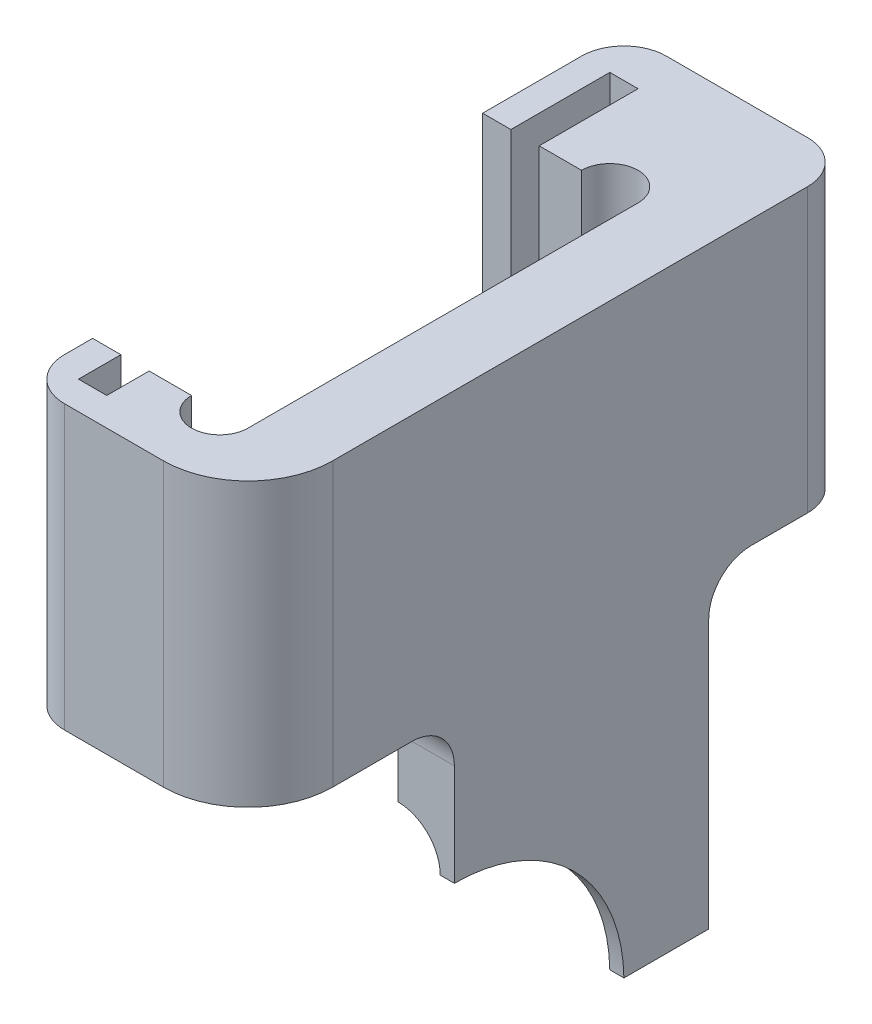
from build123d import *

# Parameters (mm, degrees)
BOSS_EXTRUDE1_DEPTH     = 20
SKETCH3_W               = 12
SKETCH3_H               = 20
BOSS_EXTRUDE2_DEPTH     = 5
FILLET1_R               = 6
FILLET2_R               = 3
SKETCH4_R               = 2
CUT_EXTRUDE1_DEPTH      = 6
SKETCH5_W               = 2
SKETCH5_H               = 20
SKETCH5_W_2             = 3
BOSS_EXTRUDE3_DEPTH     = 4
SKETCH6_W               = 2
SKETCH6_H               = 20
BOSS_EXTRUDE4_DEPTH     = 3
SKETCH7_W               = 2
SKETCH7_H               = 20
BOSS_EXTRUDE5_DEPTH     = 7
FILLET3_R               = 3
SKETCH8_W               = 18
SKETCH8_H               = 22
BOSS_EXTRUDE6_DEPTH     = 5
CUT_EXTRUDE2_DEPTH      = 36.285832851
CUT_EXTRUDE2_DEPTH_BACK = 4
CUT_EXTRUDE3_DEPTH      = 36.285832851
CUT_EXTRUDE3_DEPTH_BACK = 36.285832851
FILLET4_R               = 3
SKETCH11_W              = 18
SKETCH11_H              = 22
CUT_EXTRUDE4_DEPTH      = 1
FILLET5_R               = 3


with BuildPart() as part:
    # Sketch1 → Boss-Extrude1 (new body)
    with BuildSketch(Plane(origin=(0, 0, 0), x_dir=(1, 0, 0), z_dir=(0, 1, 0))):
        with BuildLine():
            Line((0, 15.3), (0, -12.3))
            ThreePointArc((0, -12.3), (-2, -14.3), (-4, -12.3))
            Line((-4, -12.3), (-7, -12.3))
            Line((-7, -12.3), (-7, -17.3))
            Line((-7, -17.3), (5, -17.3))
            Line((5, -17.3), (5, 20.3))
            Line((5, 20.3), (-7, 20.3))
            Line((-7, 20.3), (-7, 15.3))
            Line((-7, 15.3), (-4, 15.3))
            ThreePointArc((-4, 15.3), (-2, 17.3), (0, 15.3))
        make_face()
    extrude(amount=BOSS_EXTRUDE1_DEPTH)

    # Sketch3 → Boss-Extrude2 (add)
    with BuildSketch(Plane(origin=(0, 0, -20.3), x_dir=(-1, 0, 0), z_dir=(0, 0, -1))):
        with Locations((1, 10)):
            Rectangle(SKETCH3_W, SKETCH3_H)
    extrude(amount=BOSS_EXTRUDE2_DEPTH)

    # Fillet1
    fillet1_edges = [part.edges().sort_by_distance(p)[0] for p in [
        (5, 10, 17.3),
    ]]
    fillet(fillet1_edges, radius=FILLET1_R)

    # Fillet2
    fillet2_edges = [part.edges().sort_by_distance(p)[0] for p in [
        (5, 10, -25.3),
    ]]
    fillet(fillet2_edges, radius=FILLET2_R)

    # Sketch4 → Cut-Extrude1 (cut)
    with BuildSketch(Plane(origin=(0, 0, -25.3), x_dir=(-1, 0, 0), z_dir=(0, 0, -1))):
        with Locations((0.5, 10)):
            Circle(SKETCH4_R)
    extrude(amount=-CUT_EXTRUDE1_DEPTH, mode=Mode.SUBTRACT)

    # Sketch5 → Boss-Extrude3 (add)
    with BuildSketch(Plane.ZY.offset(7)):
        with Locations((16.3, 10)):
            Rectangle(SKETCH5_W, SKETCH5_H)
        with Locations((-23.8, 10)):
            Rectangle(SKETCH5_W_2, SKETCH5_H)
    extrude(amount=BOSS_EXTRUDE3_DEPTH)

    # Sketch6 → Boss-Extrude4 (add)
    with BuildSketch(Plane(origin=(0, 0, 15.3), x_dir=(-1, 0, 0), z_dir=(0, 0, -1))):
        with Locations((10, 10)):
            Rectangle(SKETCH6_W, SKETCH6_H)
    extrude(amount=BOSS_EXTRUDE4_DEPTH)

    # Sketch7 → Boss-Extrude5 (add)
    with BuildSketch(Plane.XY.offset(-22.3)):
        with Locations((-10, 10)):
            Rectangle(SKETCH7_W, SKETCH7_H)
    extrude(amount=BOSS_EXTRUDE5_DEPTH)

    # Fillet3
    fillet3_edges = [part.edges().sort_by_distance(p)[0] for p in [
        (-11, 10, 17.3),
        (-11, 10, -25.3),
    ]]
    fillet(fillet3_edges, radius=FILLET3_R)

    # Sketch8 → Boss-Extrude6 (add)
    with BuildSketch(Plane.ZY):
        with Locations((-6.3, -11)):
            Rectangle(SKETCH8_W, SKETCH8_H)
    extrude(amount=-BOSS_EXTRUDE6_DEPTH)

    # Sketch9 → Cut-Extrude2 (cut, two sides: drawn at the far end of the back side and taken through both)
    with BuildSketch(Plane.ZY.offset(-CUT_EXTRUDE2_DEPTH_BACK)):
        with BuildLine():
            Line((2.7, -10.2), (2.7, -7.2))
            ThreePointArc((2.7, -7.2), (-7.835653753, -11.522921748), (-12.298666607, -22))
            Line((-12.298666607, -22), (-9.298333218, -22))
            ThreePointArc((-9.298333218, -22), (-5.714273587, -13.644300146), (2.7, -10.2))
        make_face()
    extrude(amount=CUT_EXTRUDE2_DEPTH + CUT_EXTRUDE2_DEPTH_BACK, mode=Mode.SUBTRACT)

    # Sketch9<3> → Cut-Extrude3 (cut, two sides: drawn at the far end of the back side and taken through both)
    with BuildSketch(Plane.ZY.offset(-CUT_EXTRUDE3_DEPTH_BACK)):
        with BuildLine():
            Line((2.7, -22), (2.7, -10.2))
            ThreePointArc((2.7, -10.2), (-5.714273587, -13.644300146), (-9.298333218, -22))
            Line((-9.298333218, -22), (2.7, -22))
        make_face()
    extrude(amount=CUT_EXTRUDE3_DEPTH + CUT_EXTRUDE3_DEPTH_BACK, mode=Mode.SUBTRACT)

    # Fillet4
    fillet4_edges = [part.edges().sort_by_distance(p)[0] for p in [
        (4, -11.522921748, -7.835653753),
    ]]
    fillet(fillet4_edges, radius=FILLET4_R - 0.0001)  # a hair under: the kernel refuses the full size

    # Sketch11 → Cut-Extrude4 (cut)
    with BuildSketch(Plane.ZY):
        with Locations((-6.3, -11)):
            Rectangle(SKETCH11_W, SKETCH11_H)
    extrude(amount=-CUT_EXTRUDE4_DEPTH, mode=Mode.SUBTRACT)

    # Fillet5
    fillet5_edges = [part.edges().sort_by_distance(p)[0] for p in [
        (3, 0, -15.3),
        (3, 0, 2.7),
    ]]
    fillet(fillet5_edges, radius=FILLET5_R)


solid = part.part
